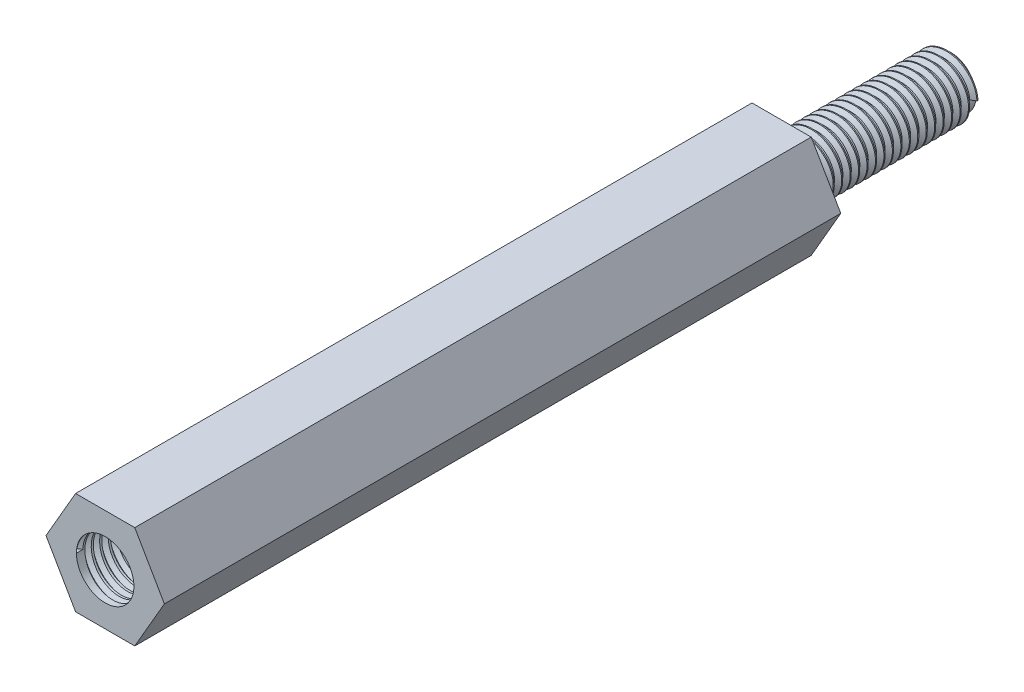
from build123d import *

# Parameters (mm, degrees)
BOSS_EXTRU_1_DEPTH      = 50
D_GAGEMENT_M31_D        = 3.4
D_GAGEMENT_M31_DEPTH    = 10
D_GAGEMENT_M31_TIP      = 1.021463052
FILETAGE1_PITCH         = 0.5
ESQUISSE12_R            = 1.5
ENL_V_MAT_EXTRU_1_DEPTH = 10
FILETAGE2_PITCH         = 0.5


with BuildPart() as part:
    # Esquisse1 → Boss.-Extru.1 (new body)
    with BuildSketch(Plane.XY):
        Polygon((5.25, 0.468911087), (7, 3.5), (5.25, 6.531088913), (1.75, 6.531088913), (0, 3.5), (1.75, 0.468911087), align=None)
    extrude(amount=BOSS_EXTRU_1_DEPTH)

    # Dégagement M31
    with Locations(Plane.XY.offset(50)):
        with Locations((3.5, 3.5)):
            Hole(D_GAGEMENT_M31_D / 2, depth=D_GAGEMENT_M31_DEPTH)
            with Locations((0, 0, -(D_GAGEMENT_M31_DEPTH + D_GAGEMENT_M31_TIP / 2))):  # 118° drill point
                Cone(0, D_GAGEMENT_M31_D / 2, D_GAGEMENT_M31_TIP, mode=Mode.SUBTRACT)

    # Filetage1: arcs per turn and ends read off the stored shape
    # Filetage1: the profile of Profil de filetage1 profile screwed along a right-hand helix through 30 turns, 6 arcs to a turn; built about Z, then put on its axis
    filetage1_z = Axis((0, 0, 0), (0, 0, 1))
    filetage1_corners = [(1.6997, 0, -0.000173205), (1.970632937, 0, 0.156249999), (1.970632937, 0, 0.218749999), (1.6997, 0, 0.375173204)]
    with BuildLine(mode=Mode.PRIVATE) as filetage1_profile:
        Line(filetage1_corners[0], filetage1_corners[1])
        Line(filetage1_corners[1], filetage1_corners[2])
        Line(filetage1_corners[2], filetage1_corners[3])
        Line(filetage1_corners[3], filetage1_corners[0])
    filetage1_cap = Face(filetage1_profile.wire())
    filetage1_turn_angles = [0, 30, 60, 90, 120, 150, 180, 210, 240, 270, 300, 330, 360]
    filetage1_turn_weights = [1, 0.8660254037844387, 1, 0.8660254037844387, 1, 0.8660254037844387, 1, 0.8660254037844387, 1, 0.8660254037844387, 1, 0.8660254037844387, 1]
    filetage1_turn_rails = [Edge.make_bspline([Vector(p[0], p[1], 0).rotate(filetage1_z, filetage1_turn_angles[k]) / filetage1_turn_weights[k] + Vector(0, 0, p[2] + FILETAGE1_PITCH * filetage1_turn_angles[k] / 360) for k in range(13)], [0, 0, 0, 1, 1, 2, 2, 3, 3, 4, 4, 5, 5, 6, 6, 6], 2, filetage1_turn_weights) for p in filetage1_corners]
    filetage1_turn_sides = [Face.make_surface_from_curves(filetage1_turn_rails[p[0]], filetage1_turn_rails[p[1]]) for p in [(0, 1), (1, 2), (2, 3), (3, 0)]]
    filetage1 = Plane(origin=(3.5, 3.5, 50), x_dir=(-1, 0, 0), z_dir=(0, 0, -1)) * Solid(Shell([*[p.moved(Location((0, 0, FILETAGE1_PITCH * i))) for i in range(30) for p in filetage1_turn_sides], filetage1_cap, filetage1_cap.rotate(filetage1_z, 10800).moved(Location((0, 0, FILETAGE1_PITCH * 10800 / 360)))]))
    add(filetage1, mode=Mode.SUBTRACT)

    # Esquisse12 → Enlèv. mat.-Extru.1 (cut)
    with BuildSketch(Plane(origin=(0, 0, 0), x_dir=(-1, 0, 0), z_dir=(0, 0, -1))):
        Polygon((-5.25, 0.468911087), (-1.75, 0.468911087), (0, 3.5), (-1.75, 6.531088913), (-5.25, 6.531088913), (-7, 3.5), align=None)
        with Locations((-3.5, 3.5)):
            Circle(ESQUISSE12_R, mode=Mode.SUBTRACT)
    extrude(amount=-ENL_V_MAT_EXTRU_1_DEPTH, mode=Mode.SUBTRACT)

    # Filetage2: arcs per turn and ends read off the stored shape
    # Filetage2: the profile of Profil de filetage2 profile screwed along a right-hand helix through 30 turns, 6 arcs to a turn; built about Z, then put on its axis
    filetage2_z = Axis((0, 0, 0), (0, 0, 1))
    filetage2_corners = [(1.4997, 0, -0.000173205), (1.770632938, 0, 0.156249999), (1.770632938, 0, 0.218749999), (1.4997, 0, 0.375173204)]
    with BuildLine(mode=Mode.PRIVATE) as filetage2_profile:
        Line(filetage2_corners[0], filetage2_corners[1])
        Line(filetage2_corners[1], filetage2_corners[2])
        Line(filetage2_corners[2], filetage2_corners[3])
        Line(filetage2_corners[3], filetage2_corners[0])
    filetage2_cap = Face(filetage2_profile.wire())
    filetage2_turn_angles = [0, 30, 60, 90, 120, 150, 180, 210, 240, 270, 300, 330, 360]
    filetage2_turn_weights = [1, 0.8660254037844387, 1, 0.8660254037844387, 1, 0.8660254037844387, 1, 0.8660254037844387, 1, 0.8660254037844387, 1, 0.8660254037844387, 1]
    filetage2_turn_rails = [Edge.make_bspline([Vector(p[0], p[1], 0).rotate(filetage2_z, filetage2_turn_angles[k]) / filetage2_turn_weights[k] + Vector(0, 0, p[2] + FILETAGE2_PITCH * filetage2_turn_angles[k] / 360) for k in range(13)], [0, 0, 0, 1, 1, 2, 2, 3, 3, 4, 4, 5, 5, 6, 6, 6], 2, filetage2_turn_weights) for p in filetage2_corners]
    filetage2_turn_sides = [Face.make_surface_from_curves(filetage2_turn_rails[p[0]], filetage2_turn_rails[p[1]]) for p in [(0, 1), (1, 2), (2, 3), (3, 0)]]
    filetage2 = Plane(origin=(3.5, 3.5, 0), x_dir=(1, 0, 0), z_dir=(0, 0, 1)) * Solid(Shell([*[p.moved(Location((0, 0, FILETAGE2_PITCH * i))) for i in range(30) for p in filetage2_turn_sides], filetage2_cap, filetage2_cap.rotate(filetage2_z, 10800).moved(Location((0, 0, FILETAGE2_PITCH * 10800 / 360)))]))
    add(filetage2)


solid = part.part
